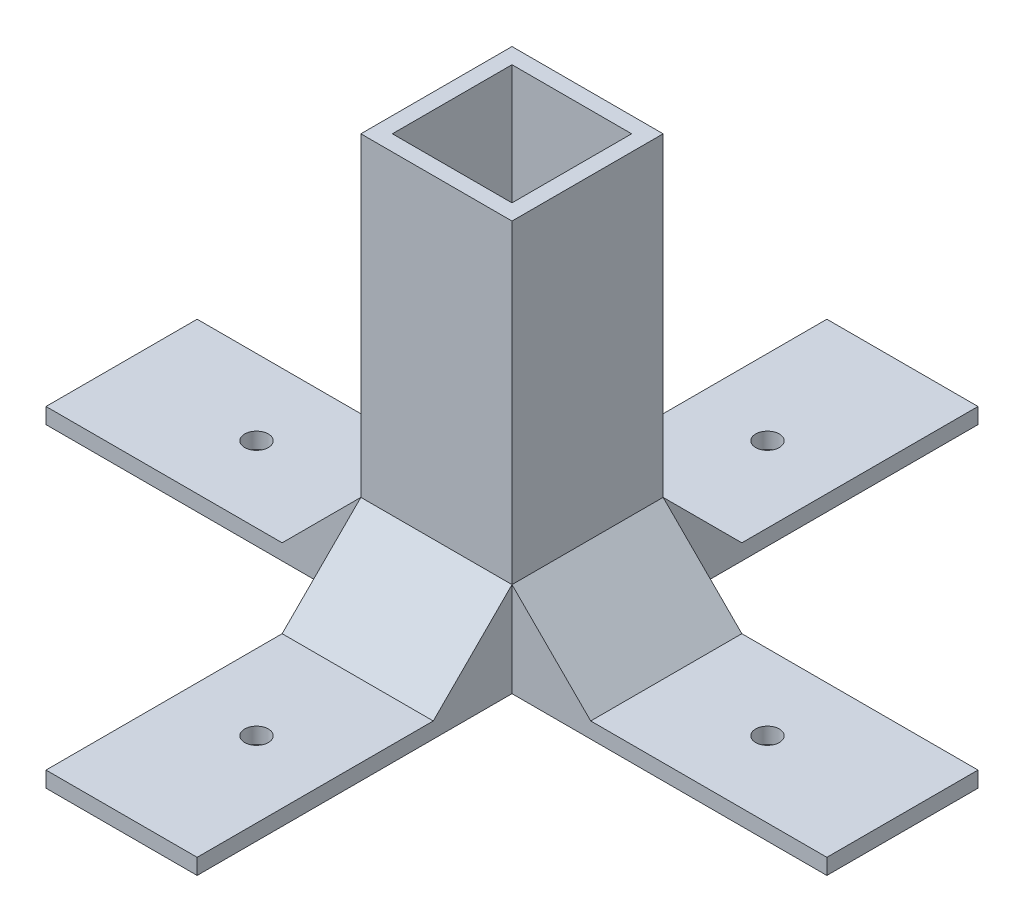
from build123d import *

# Parameters (mm, degrees)
SKETCH1_W           = 19.2
SKETCH1_H           = 19.2
SKETCH1_W_2         = 15.2
SKETCH1_H_2         = 15.2
EXTRUDE_THIN1_DEPTH = 50
BOSS_EXTRUDE1_DEPTH = 2
CHAMFER1_SIZE       = 10
CHAMFER2_SIZE       = 10
CHAMFER3_SIZE       = 10
CHAMFER4_SIZE       = 10
SKETCH6_R           = 1.5
CUT_EXTRUDE1_DEPTH  = 87.141279303


# Some blends are built 0.0001 mm under size
with BuildPart() as part:
    # Sketch1 → Extrude-Thin1 (new body)
    with BuildSketch(Plane(origin=(0, 0, 0), x_dir=(1, 0, 0), z_dir=(0, 1, 0))):
        Rectangle(SKETCH1_W, SKETCH1_H)
        Rectangle(SKETCH1_W_2, SKETCH1_H_2, mode=Mode.SUBTRACT)
    extrude(amount=EXTRUDE_THIN1_DEPTH)

    # Sketch2 → Boss-Extrude1 (add)
    with BuildSketch(Plane(origin=(0, 0, 0), x_dir=(1, 0, 0), z_dir=(0, 1, 0))):
        Polygon((9.6, 9.6), (49.6, 9.6), (49.6, -9.6), (9.6, -9.6), (9.6, -49.6), (-9.6, -49.6), (-9.6, -9.6), (-49.6, -9.6), (-49.6, 9.6), (-9.6, 9.6), (-9.6, 49.6), (9.6, 49.6), align=None)
    extrude(amount=-BOSS_EXTRUDE1_DEPTH)

    # Chamfer1
    # the kernel refuses this chamfer: 10 mm, written as the material it adds along each edge
    with BuildSketch(Plane(origin=(-9.6, 0, 9.6), x_dir=(0, 1, 0), z_dir=(0, 0, -1))) as chamfer1_piece_1:
        Polygon((CHAMFER1_SIZE, 0), (0, -CHAMFER1_SIZE), (0, 0), align=None)
    extrude(amount=19.2)

    # Chamfer2
    # the kernel refuses this chamfer: 10 mm, written as the material it adds along each edge
    with BuildSketch(Plane(origin=(-9.6, 0, -9.6), x_dir=(0, 1, 0), z_dir=(1, 0, 0))) as chamfer2_piece_1:
        Polygon((CHAMFER2_SIZE, 0), (0, -CHAMFER2_SIZE), (0, 0), align=None)
    extrude(amount=19.2)

    # Chamfer3
    # the kernel refuses this chamfer: 10 mm, written as the material it adds along each edge
    with BuildSketch(Plane(origin=(9.6, 0, -9.6), x_dir=(0, 1, 0), z_dir=(0, 0, 1))) as chamfer3_piece_1:
        Polygon((CHAMFER3_SIZE, 0), (0, -CHAMFER3_SIZE), (0, 0), align=None)
    extrude(amount=19.2)

    # Chamfer4
    chamfer4_edges = [part.edges().sort_by_distance(p)[0] for p in [
        (0, 0, 9.6),
    ]]
    chamfer(chamfer4_edges, length=CHAMFER4_SIZE - 0.0001)  # a hair under: the kernel refuses the full size

    # Sketch6 → Cut-Extrude1 (cut, through all)
    with BuildSketch(Plane(origin=(0, 0, 0), x_dir=(1, 0, 0), z_dir=(0, 1, 0))):
        with Locations(Location((0, 32.455385939, 0), (0, 0, 270))):
            Circle(SKETCH6_R)
        with Locations(Location((32.455385939, 0, 0), (0, 0, 270))):
            Circle(SKETCH6_R)
        with Locations(Location((0, -32.455385939, 0), (0, 0, 270))):
            Circle(SKETCH6_R)
        with Locations(Location((-32.455385939, 0, 0), (0, 0, 270))):
            Circle(SKETCH6_R)
    extrude(amount=-CUT_EXTRUDE1_DEPTH, mode=Mode.SUBTRACT)


solid = part.part
